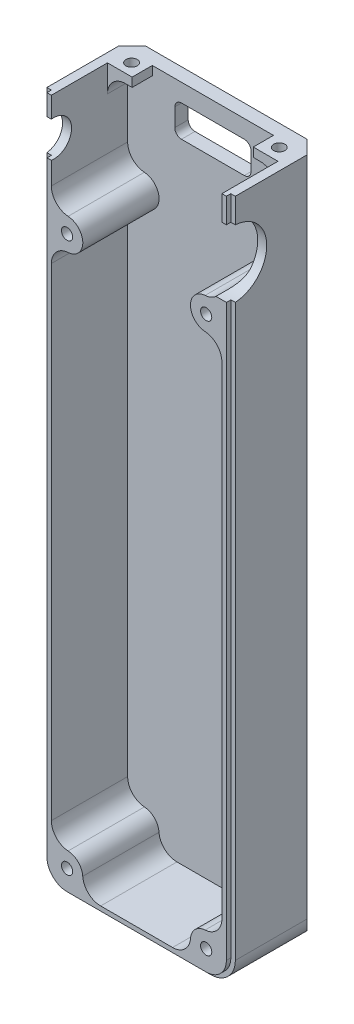
from build123d import *

# Parameters (mm, degrees)
SKETCH_1_W           = 42
SKETCH_1_H           = 153
EXTRUDE_1_DEPTH      = 20
SKETCH_2_W           = 38
SKETCH_2_H           = 149
CUT_EXTRUDE_1_DEPTH  = 17
EXTRUDE_3_DEPTH      = 17
FILLET_START         = 2
FILLET_2_DEPTH       = 18
CHAMFER_1_SIZE       = 3
CUT_EXTRUDE_3_DEPTH  = 82.812285141
SKETCH_8_R           = 4
CUT_EXTRUDE_4_DEPTH  = 90.533513279
SKETCH_13_W          = 27
SKETCH_13_H          = 9.8440201
CUT_EXTRUDE_6_DEPTH  = 17
SKETCH_14_W          = 38
SKETCH_14_H          = 15.071373518
CUT_EXTRUDE_7_DEPTH  = 12.5
CUT_EXTRUDE_8_DEPTH  = 1
M3X0_51_D            = 2.5
M3X0_51_DEPTH        = 12.5
M3X0_51_TIP          = 0.751075774
M3X0_52_D            = 2.5
M3X0_52_DEPTH        = 12.5
M3X0_52_TIP          = 0.751075774
CUT_EXTRUDE_9_REACH  = 91.534
SKETCH_22_R          = 7.5
CUT_EXTRUDE_10_REACH = 91.534
SKETCH_23_R          = 4
CUT_EXTRUDE_11_REACH = 83.812
SKETCH_24_W          = 17
SKETCH_24_H          = 7
FILLET_3_R           = 1.5


with BuildPart() as part:
    # Эскиз1 → Бобышка-Вытянуть1 (new body)
    with BuildSketch(Plane.XY):
        Rectangle(SKETCH_1_W, SKETCH_1_H)
    extrude(amount=EXTRUDE_1_DEPTH)

    # Эскиз2 → Вырез-Вытянуть1 (cut)
    with BuildSketch(Plane.XY.offset(20)):
        Rectangle(SKETCH_2_W, SKETCH_2_H)
    extrude(amount=-CUT_EXTRUDE_1_DEPTH, mode=Mode.SUBTRACT)

    # Эскиз3 → Бобышка-Вытянуть3 (add)
    with BuildSketch(Plane.XY.offset(20)):
        with BuildLine():
            Line((-19, -71), (-19, -74.5))
            Line((-19, -74.5), (-15.5, -74.5))
            ThreePointArc((-15.5, -74.5), (-13.025126266, -68.525126266), (-19, -71))
        make_face()
        with BuildLine():
            Line((19, -71), (19, -74.5))
            Line((19, -74.5), (15.5, -74.5))
            ThreePointArc((15.5, -74.5), (13.025126266, -68.525126266), (19, -71))
        make_face()
        with BuildLine():
            Line((-15.5, 55), (-19, 55))
            Line((-19, 55), (-19, 48))
            Line((-19, 48), (-15.5, 48))
            ThreePointArc((-15.5, 48), (-12, 51.5), (-15.5, 55))
        make_face()
        with BuildLine():
            Line((15.5, 55), (19, 55))
            Line((19, 55), (19, 48))
            Line((19, 48), (15.5, 48))
            ThreePointArc((15.5, 48), (12, 51.5), (15.5, 55))
        make_face()
    extrude(amount=-EXTRUDE_3_DEPTH)

    # Скругление2: read off the stored shape, not the designer's step
    # Скругление2 outline → Скругление2 (add)
    with BuildSketch(Plane.XY.offset(FILLET_START)):
        with BuildLine():
            ThreePointArc((19, 58.983314774), (17.921186974, 56.25079457), (15.266666667, 54.992213561))
            ThreePointArc((15.266666667, 54.992213561), (15.383268392, 54.998052849), (15.5, 55))
            Line((15.5, 55), (19, 55))
            Line((19, 55), (19, 58.983314774))
        make_face()
        with BuildLine():
            ThreePointArc((15.5, 48), (15.383268392, 48.001947151), (15.266666667, 48.007786439))
            ThreePointArc((15.266666667, 48.007786439), (17.921186974, 46.74920543), (19, 44.016685226))
            Line((19, 44.016685226), (19, 48))
            Line((19, 48), (15.5, 48))
        make_face()
        with BuildLine():
            ThreePointArc((15, 74.5), (17.828427125, 73.328427125), (19, 70.5))
            Line((19, 70.5), (19, 74.5))
            Line((19, 74.5), (15, 74.5))
        make_face()
        with BuildLine():
            Line((19, -71), (19, -63.516685226))
            ThreePointArc((19, -63.516685226), (17.921186974, -66.24920543), (15.266666667, -67.507786439))
            ThreePointArc((15.266666667, -67.507786439), (17.890955179, -68.443961399), (19, -71))
        make_face()
        with BuildLine():
            ThreePointArc((-19, 70.5), (-17.828427125, 73.328427125), (-15, 74.5))
            Line((-15, 74.5), (-19, 74.5))
            Line((-19, 74.5), (-19, 70.5))
        make_face()
        with BuildLine():
            ThreePointArc((15.5, -74.5), (12.943961399, -73.390955179), (12.007786439, -70.766666667))
            ThreePointArc((12.007786439, -70.766666667), (10.74920543, -73.421186974), (8.016685226, -74.5))
            Line((8.016685226, -74.5), (15.5, -74.5))
        make_face()
        with BuildLine():
            ThreePointArc((-15.266666667, 54.992213561), (-17.921186974, 56.25079457), (-19, 58.983314774))
            Line((-19, 58.983314774), (-19, 55))
            Line((-19, 55), (-15.5, 55))
            ThreePointArc((-15.5, 55), (-15.383268392, 54.998052849), (-15.266666667, 54.992213561))
        make_face()
        with BuildLine():
            Line((-15.5, -74.5), (-8.016685226, -74.5))
            ThreePointArc((-8.016685226, -74.5), (-10.74920543, -73.421186974), (-12.007786439, -70.766666667))
            ThreePointArc((-12.007786439, -70.766666667), (-12.943961399, -73.390955179), (-15.5, -74.5))
        make_face()
        with BuildLine():
            ThreePointArc((-19, 44.016685226), (-17.921186974, 46.74920543), (-15.266666667, 48.007786439))
            ThreePointArc((-15.266666667, 48.007786439), (-15.383268392, 48.001947151), (-15.5, 48))
            Line((-15.5, 48), (-19, 48))
            Line((-19, 48), (-19, 44.016685226))
        make_face()
        with BuildLine():
            ThreePointArc((-19, -71), (-17.890955179, -68.443961399), (-15.266666667, -67.507786439))
            ThreePointArc((-15.266666667, -67.507786439), (-17.921186974, -66.24920543), (-19, -63.516685226))
            Line((-19, -63.516685226), (-19, -71))
        make_face()
    extrude(amount=FILLET_2_DEPTH)

    # Фаска1
    chamfer_1_edges = [part.edges().sort_by_distance(p)[0] for p in [
        (-21, 0, 0),
        (21, 0, 0),
    ]]
    chamfer(chamfer_1_edges, length=CHAMFER_1_SIZE)

    # Эскиз7 → Вырез-Вытянуть3 (cut, through all)
    with BuildSketch(Plane.XY.offset(20)):
        with BuildLine():
            Line((-21, -71), (-21, -76.5))
            Line((-21, -76.5), (-15.5, -76.5))
            ThreePointArc((-15.5, -76.5), (-19.389087297, -74.889087297), (-21, -71))
        make_face()
        with BuildLine():
            Line((21, -76.5), (15.5, -76.5))
            ThreePointArc((15.5, -76.5), (19.389087297, -74.889087297), (21, -71))
            Line((21, -71), (21, -76.5))
        make_face()
    extrude(amount=-CUT_EXTRUDE_3_DEPTH, mode=Mode.SUBTRACT)

    # Эскиз8 → Вырез-Вытянуть4 (cut, through all)
    with BuildSketch(Plane.ZY.offset(21)):
        with Locations((-3, -58.5)):
            Circle(SKETCH_8_R)
        with Locations((-3, -38.5)):
            Circle(SKETCH_8_R)
        with Locations((-3, -18.5)):
            Circle(SKETCH_8_R)
        with Locations((-3, 1.5)):
            Circle(SKETCH_8_R)
        with Locations((-3, 21.5)):
            Circle(SKETCH_8_R)
        with Locations((-3, 41.5)):
            Circle(SKETCH_8_R)
        with Locations((-3, 61.5)):
            Circle(SKETCH_8_R)
    extrude(amount=-CUT_EXTRUDE_4_DEPTH, mode=Mode.SUBTRACT)

    # Эскиз13 → Вырез-Вытянуть6 (cut)
    with BuildSketch(Plane.XY.offset(20)):
        with Locations((0, 76.5)):
            Rectangle(SKETCH_13_W, SKETCH_13_H)
    extrude(amount=-CUT_EXTRUDE_6_DEPTH, mode=Mode.SUBTRACT)

    # Эскиз14 → Вырез-Вытянуть7 (cut)
    with BuildSketch(Plane.XY.offset(20)):
        with Locations((0, 76.5)):
            Rectangle(SKETCH_14_W, SKETCH_14_H)
    extrude(amount=-CUT_EXTRUDE_7_DEPTH, mode=Mode.SUBTRACT)

    # Эскиз15 → Вырез-Вытянуть8 (cut)
    with BuildSketch(Plane.XY.offset(20)):
        with BuildLine():
            Line((-21, 76.5), (-21, -71))
            ThreePointArc((-21, -71), (-19.389087297, -74.889087297), (-15.5, -76.5))
            Line((-15.5, -76.5), (15.5, -76.5))
            ThreePointArc((15.5, -76.5), (19.389087297, -74.889087297), (21, -71))
            Line((21, -71), (21, 76.5))
            Line((21, 76.5), (20, 76.5))
            Line((20, 76.5), (20, -71))
            ThreePointArc((20, -71), (18.681980515, -74.181980515), (15.5, -75.5))
            Line((15.5, -75.5), (-15.5, -75.5))
            ThreePointArc((-15.5, -75.5), (-18.681980515, -74.181980515), (-20, -71))
            Line((-20, -71), (-20, 76.5))
            Line((-20, 76.5), (-21, 76.5))
        make_face()
    extrude(amount=-CUT_EXTRUDE_8_DEPTH, mode=Mode.SUBTRACT)

    # Отверстие обработанное метчиком M3x0.51
    with Locations(Plane.XY.offset(20)):
        with Locations((-15.5, 51.5), (15.5, 51.5), (15.5, -71), (-15.5, -71)):
            Hole(M3X0_51_D / 2, depth=M3X0_51_DEPTH)
            with Locations((0, 0, -(M3X0_51_DEPTH + M3X0_51_TIP / 2))):  # 118° drill point
                Cone(0, M3X0_51_D / 2, M3X0_51_TIP, mode=Mode.SUBTRACT)

    # Отверстие обработанное метчиком M3x0.52
    with Locations(Plane(origin=(0, 76.5, 0), x_dir=(1, 0, 0), z_dir=(0, 1, 0))):
        with Locations((-16.349186161, -4.77912666), (16.467977598, -4.67216637)):
            Hole(M3X0_52_D / 2, depth=M3X0_52_DEPTH)
            with Locations((0, 0, -(M3X0_52_DEPTH + M3X0_52_TIP / 2))):  # 118° drill point
                Cone(0, M3X0_52_D / 2, M3X0_52_TIP, mode=Mode.SUBTRACT)

    # Эскиз22 → Вырез-Вытянуть9 (cut, up to next)
    with BuildSketch(Plane(origin=(21, 0, 0), x_dir=(0, 0, -1), z_dir=(1, 0, 0)), mode=Mode.PRIVATE) as cut_extrude_9_sk1:
        with Locations((-19.5, 63.5)):
            Circle(SKETCH_22_R)
    cut_extrude_9_tool1 = extrude(cut_extrude_9_sk1.sketch, amount=-CUT_EXTRUDE_9_REACH, mode=Mode.PRIVATE) & part.part
    add(cut_extrude_9_tool1.solids().sort_by_distance((21, 63.5, 19.5))[0], mode=Mode.SUBTRACT)

    # Эскиз23 → Вырез-Вытянуть10 (cut, up to next)
    with BuildSketch(Plane.ZY.offset(21), mode=Mode.PRIVATE) as cut_extrude_10_sk1:
        with Locations((19.5, 67.89)):
            Circle(SKETCH_23_R)
    cut_extrude_10_tool1 = extrude(cut_extrude_10_sk1.sketch, amount=-CUT_EXTRUDE_10_REACH, mode=Mode.PRIVATE) & part.part
    add(cut_extrude_10_tool1.solids().sort_by_distance((-21, 67.89, 19.5))[0], mode=Mode.SUBTRACT)

    # Эскиз24 → Вырез-Вытянуть11 (cut, up to next)
    with BuildSketch(Plane(origin=(0, 0, 0), x_dir=(-1, 0, 0), z_dir=(0, 0, -1)), mode=Mode.PRIVATE) as cut_extrude_11_sk1:
        with Locations((0, 69)):
            Rectangle(SKETCH_24_W, SKETCH_24_H)
    cut_extrude_11_tool1 = extrude(cut_extrude_11_sk1.sketch, amount=-CUT_EXTRUDE_11_REACH, mode=Mode.PRIVATE) & part.part
    add(cut_extrude_11_tool1.solids().sort_by_distance((0, 69, 0))[0], mode=Mode.SUBTRACT)

    # Скругление3
    fillet_3_edges = [part.edges().sort_by_distance(p)[0] for p in [
        (-8.5, 72.5, 1.5),
        (-8.5, 65.5, 1.5),
        (8.5, 65.5, 1.5),
        (8.5, 72.5, 1.5),
    ]]
    fillet(fillet_3_edges, radius=FILLET_3_R)


solid = part.part
